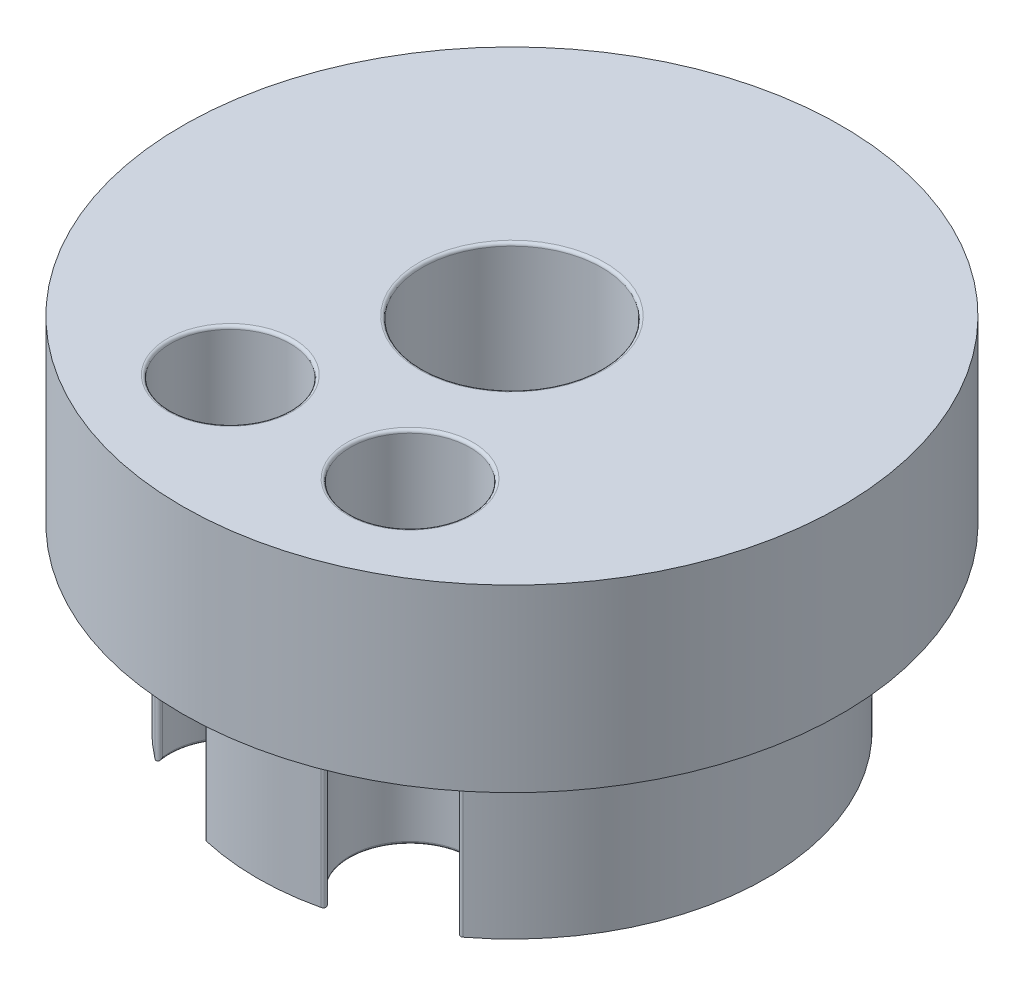
from build123d import *

# Parameters (mm, degrees)
SKETCH1_R           = 0.55
BOSS_EXTRUDE1_DEPTH = 0.3
SKETCH2_R           = 0.425
BOSS_EXTRUDE2_DEPTH = 0.3
SKETCH3_R           = 0.15
SKETCH3_R_2         = 0.1
CUT_EXTRUDE1_DEPTH  = 1.982344135
FILLET5_R           = 0.005


with BuildPart() as part:
    # Sketch1 → Boss-Extrude1 (new body)
    with BuildSketch(Plane(origin=(0, 0, 0), x_dir=(1, 0, 0), z_dir=(0, 1, 0))):
        Circle(SKETCH1_R)
    extrude(amount=-BOSS_EXTRUDE1_DEPTH)

    # Sketch2 → Boss-Extrude2 (add)
    with BuildSketch(Plane.XZ.offset(0.3)):
        Circle(SKETCH2_R)
    extrude(amount=BOSS_EXTRUDE2_DEPTH)

    # Sketch3 → Cut-Extrude1 (cut, through all)
    with BuildSketch(Plane(origin=(0, 0, 0), x_dir=(1, 0, 0), z_dir=(0, 1, 0))):
        Circle(SKETCH3_R)
        with Locations((0.15, -0.32)):
            Circle(SKETCH3_R_2)
        with Locations((-0.15, -0.32)):
            Circle(SKETCH3_R_2)
    extrude(amount=-CUT_EXTRUDE1_DEPTH, mode=Mode.SUBTRACT)

    # Fillet5
    fillet5_edges = [part.edges().sort_by_distance(p)[0] for p in [
        (-0.15, 0, 0),
        (-0.15, -0.6, 0),
        (0.05, 0, 0.32),
        (0.095958554, -0.6, 0.235860104),
        (-0.25, 0, 0.32),
        (-0.163220488, -0.6, 0.220877759),
        (0.246504374, -0.45, 0.346208887),
        (0.108409557, -0.45, 0.410940833),
        (0.192443388, -0.3, 0.410545894),
        (-0.108409557, -0.45, 0.410940833),
        (-0.246504374, -0.45, 0.346208887),
        (-0.192443388, -0.3, 0.410545894),
    ]]
    fillet(fillet5_edges, radius=FILLET5_R)


solid = part.part
